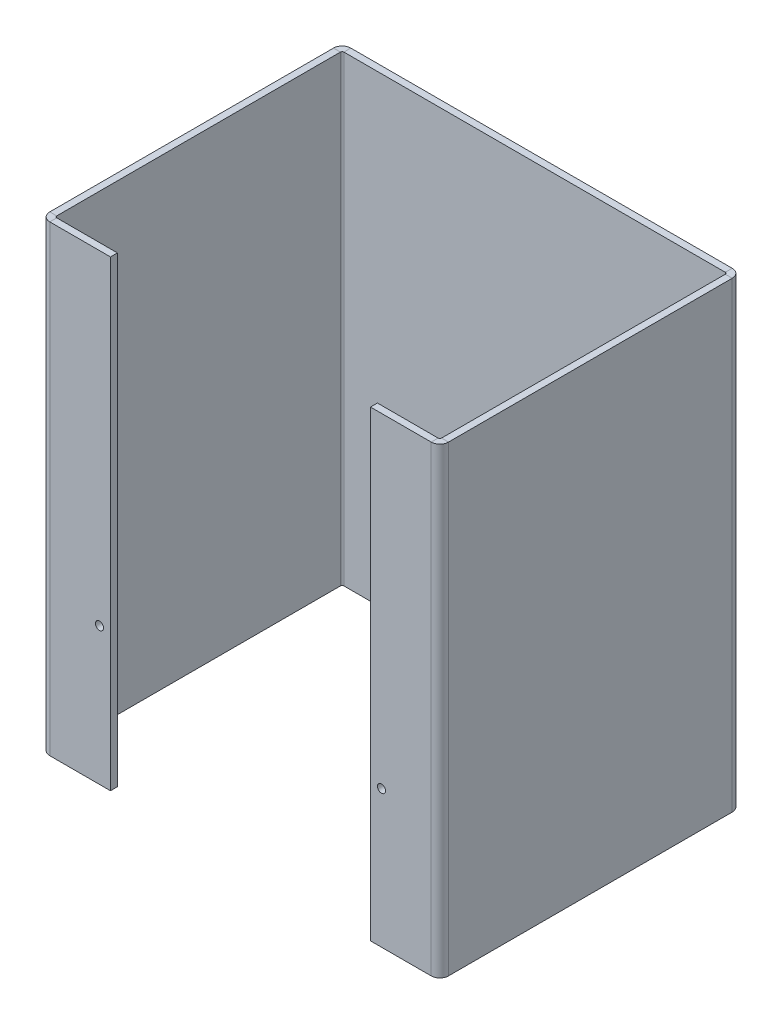
from build123d import *

# Parameters (mm, degrees)
SKETCH1_W                    = 165
SKETCH1_H                    = 200
BASE_FLANGE1_DEPTH           = 3
SKETCH6_W                    = 130
SKETCH6_H                    = 200
TAB1_DEPTH                   = 3
SKETCHED_START               = -100
SKETCHED_BEND1_DEPTH         = 200
SKETCHED_BEND1_2_DEPTH       = 200
SKETCH10_W                   = 130
SKETCH10_H                   = 200
TAB2_DEPTH                   = 3
SKETCHED_BEND2_DEPTH         = 200
SKETCHED_BEND2_2_DEPTH       = 200
EDGE_FLANGE1_STRIP_W         = 13.4732
EDGE_FLANGE1_STRIP_H         = 3
EDGE_FLANGE1_STRIP_CUT_DEPTH = 200
EDGE_FLANGE1_DEPTH           = 200
EDGE_FLANGE2_STRIP_W         = 13.4732
EDGE_FLANGE2_STRIP_H         = 3
EDGE_FLANGE2_STRIP_CUT_DEPTH = 200
EDGE_FLANGE2_DEPTH           = 200
SKETCH20_R                   = 1.75
CUT_EXTRUDE1_DEPTH           = 10


# Read off the part's stored shape, not the designer's step: Sketched Bend1, Sketched Bend2
# Sheet-metal steps are written as plain solids
with BuildPart() as part:
    # Sketch1 → Base-Flange1 (new body)
    with BuildSketch(Plane.XY):
        Rectangle(SKETCH1_W, SKETCH1_H)
    extrude(amount=-BASE_FLANGE1_DEPTH)

    # Sketch6 → Tab1 (add)
    with BuildSketch(Plane(origin=(0, 0, -3), x_dir=(-1, 0, 0), z_dir=(0, 0, -1))):
        with Locations((-147.5, 0)):
            Rectangle(SKETCH6_W, SKETCH6_H)
    extrude(amount=-TAB1_DEPTH)

    # Sketched Bend1 outline → Sketched Bend1 (cut)
    with BuildSketch(Plane(origin=(0, 0, 0), x_dir=(1, 0, 0), z_dir=(0, 1, 0)).offset(SKETCHED_START)):
        with BuildLine():
            ThreePointArc((82.5, 3), (84.867467001, 2.154295979), (86.163277222, 0))
            Line((86.163277222, 0), (212.5, 0))
            Line((212.5, 0), (212.5, 3))
            Line((212.5, 3), (82.5, 3))
        make_face()
    extrude(amount=SKETCHED_BEND1_DEPTH, mode=Mode.SUBTRACT)

    # Sketched Bend1 2 outline → Sketched Bend1 2 (add)
    with BuildSketch(Plane(origin=(0, 0, 0), x_dir=(1, 0, 0), z_dir=(0, 1, 0)).offset(SKETCHED_START)):
        with BuildLine():
            Line((86.2366, -127.223356935), (86.2366, -0.7366))
            ThreePointArc((86.2366, -0.7366), (86.218224121, -0.36647982), (86.163277222, 0))
            Line((86.163277222, 0), (82.5, 0))
            ThreePointArc((82.5, 0), (83.020854855, -0.215745145), (83.2366, -0.7366))
            Line((83.2366, -0.7366), (83.2366, -127.223356935))
            Line((83.2366, -127.223356935), (86.2366, -127.223356935))
        make_face()
    extrude(amount=SKETCHED_BEND1_2_DEPTH)

    # Sketch10 → Tab2 (add)
    with BuildSketch(Plane.XY):
        with Locations((-147.5, 0)):
            Rectangle(SKETCH10_W, SKETCH10_H)
    extrude(amount=-TAB2_DEPTH)

    # Sketched Bend2 outline → Sketched Bend2 (cut)
    with BuildSketch(Plane(origin=(0, 0, 0), x_dir=(1, 0, 0), z_dir=(0, 1, 0)).offset(SKETCHED_START)):
        with BuildLine():
            Line((-212.5, 0), (-86.163277222, 0))
            ThreePointArc((-86.163277222, 0), (-84.867467001, 2.154295979), (-82.5, 3))
            Line((-82.5, 3), (-212.5, 3))
            Line((-212.5, 3), (-212.5, 0))
        make_face()
    extrude(amount=SKETCHED_BEND2_DEPTH, mode=Mode.SUBTRACT)

    # Sketched Bend2 2 outline → Sketched Bend2 2 (add)
    with BuildSketch(Plane(origin=(0, 0, 0), x_dir=(1, 0, 0), z_dir=(0, 1, 0)).offset(SKETCHED_START)):
        with BuildLine():
            Line((-86.2366, -0.7366), (-86.2366, -127.223356935))
            Line((-86.2366, -127.223356935), (-83.2366, -127.223356935))
            Line((-83.2366, -127.223356935), (-83.2366, -0.7366))
            ThreePointArc((-83.2366, -0.7366), (-83.020854855, -0.215745145), (-82.5, 0))
            Line((-82.5, 0), (-86.163277222, 0))
            ThreePointArc((-86.163277222, 0), (-86.218224121, -0.36647982), (-86.2366, -0.7366))
        make_face()
    extrude(amount=SKETCHED_BEND2_2_DEPTH)

    # Edge-Flange1 strip (across the edge) → Edge-Flange1 strip cut (cut)
    with BuildSketch(Plane(origin=(-83.2366, 100, 127.223356935), x_dir=(0, 0, -1), z_dir=(0, -1, 0))):
        with Locations((-3, -1.5)):
            Rectangle(EDGE_FLANGE1_STRIP_W, EDGE_FLANGE1_STRIP_H)
    extrude(amount=EDGE_FLANGE1_STRIP_CUT_DEPTH, mode=Mode.SUBTRACT)

    # Edge-Flange1 section (across the edge) → Edge-Flange1 (add)
    with BuildSketch(Plane(origin=(-83.2366, 100, 127.223356935), x_dir=(0, 0, -1), z_dir=(0, -1, 0))):
        with BuildLine():
            Line((0, 0.7366), (0, 27))
            Line((0, 27), (3, 27))
            Line((3, 27), (3, 0.7366))
            ThreePointArc((3, 0.7366), (3.215745145, 0.215745145), (3.7366, 0))
            Line((3.7366, 0), (3.7366, -3))
            ThreePointArc((3.7366, -3), (1.094424801, -1.905575199), (0, 0.7366))
        make_face()
    extrude(amount=EDGE_FLANGE1_DEPTH)

    # Edge-Flange2 strip (across the edge) → Edge-Flange2 strip cut (cut)
    with BuildSketch(Plane(origin=(83.2366, -100, 127.223356935), x_dir=(0, 0, -1), z_dir=(0, 1, 0))):
        with Locations((-3, -1.5)):
            Rectangle(EDGE_FLANGE2_STRIP_W, EDGE_FLANGE2_STRIP_H)
    extrude(amount=EDGE_FLANGE2_STRIP_CUT_DEPTH, mode=Mode.SUBTRACT)

    # Edge-Flange2 section (across the edge) → Edge-Flange2 (add)
    with BuildSketch(Plane(origin=(83.2366, -100, 127.223356935), x_dir=(0, 0, -1), z_dir=(0, 1, 0))):
        with BuildLine():
            Line((0, 0.7366), (0, 27))
            Line((0, 27), (3, 27))
            Line((3, 27), (3, 0.7366))
            ThreePointArc((3, 0.7366), (3.215745145, 0.215745145), (3.7366, 0))
            Line((3.7366, 0), (3.7366, -3))
            ThreePointArc((3.7366, -3), (1.094424801, -1.905575199), (0, 0.7366))
        make_face()
    extrude(amount=EDGE_FLANGE2_DEPTH)

    # Sketch20 → Cut-Extrude1 (cut)
    with BuildSketch(Plane(origin=(0, 0, 124.223356935), x_dir=(-1, 0, 0), z_dir=(0, 0, -1))):
        with Locations(Location((-60.9866, -40.55, 0), (0, 0, 90))):
            Circle(SKETCH20_R)
        with Locations(Location((60.9866, -40.55, 0), (0, 0, 90))):
            Circle(SKETCH20_R)
    extrude(amount=-CUT_EXTRUDE1_DEPTH, mode=Mode.SUBTRACT)


solid = part.part
